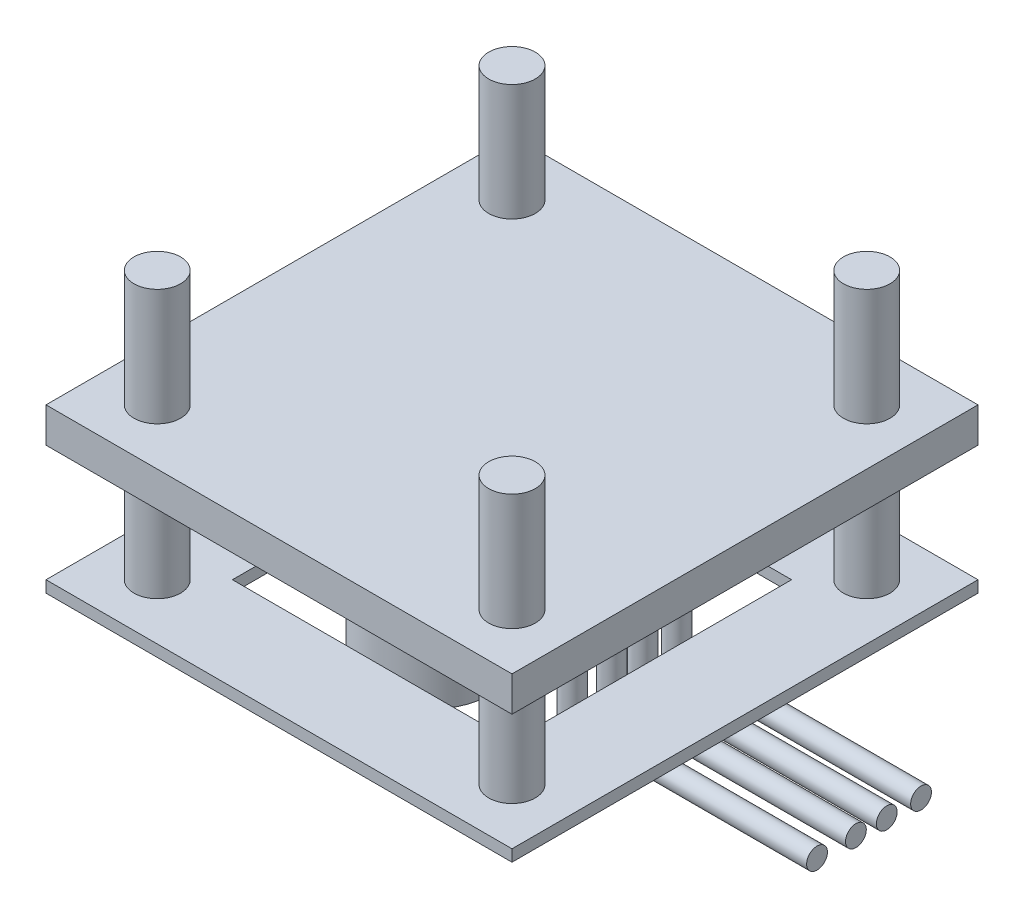
from build123d import *

# Parameters (mm, degrees)
SKETCH_2_W           = 40
SKETCH_2_H           = 40
SKETCH_2_W_2         = 24
SKETCH_2_H_2         = 24
EXTRUDE_2_DEPTH      = 1
SKETCH_3_R           = 2
SKETCH_3_R_2         = 5.125
SKETCH_3_W           = 3
SKETCH_3_H           = 12
CUT_EXTRUDE_1_DEPTH  = 3
EXTRUDE_START        = 10
SKETCH_9_W           = 40
SKETCH_9_H           = 40
EXTRUDE_4_DEPTH      = 3
SKETCH_3_3_R         = 2
EXTRUDE_5_DEPTH      = 24
EXTRUDE_START_2      = -2
SKETCH_2_8_R         = 2
EXTRUDE_6_DEPTH      = 2
SKETCH_11_W          = 28.649920568
SKETCH_11_H          = 15.870303346
EXTRUDE_7_DEPTH      = 2
EXTRUDE_8_DEPTH      = 10
EXTRUDE_8_DEPTH_BACK = 9.496904145
SKETCH_12_R          = 5.125
SKETCH_13_W          = 3
SKETCH_13_H          = 12
EXTRUDE_9_DEPTH      = 3
SKETCH_14_R          = 0.926290341
EXTRUDE_10_DEPTH     = 9
EXTRUDE_START_3      = 9.5
SKETCH_16_R          = 0.89368598
EXTRUDE_11_DEPTH     = 21


with BuildPart() as part:
    # 草图2 → 凸台-拉伸2 (new body)
    with BuildSketch(Plane(origin=(0, 0, 0), x_dir=(1, 0, 0), z_dir=(0, 1, 0))):
        Rectangle(SKETCH_2_W, SKETCH_2_H)
        Rectangle(SKETCH_2_W_2, SKETCH_2_H_2, mode=Mode.SUBTRACT)
    extrude(amount=EXTRUDE_2_DEPTH)

    # 草图3 → 切除-拉伸1 (cut)
    with BuildSketch(Plane(origin=(0, 0, 0), x_dir=(1, 0, 0), z_dir=(0, 1, 0))):
        with Locations((-15.224798987, -15.224798987)):
            Circle(SKETCH_3_R)
        with Locations((15.224798987, -15.224798987)):
            Circle(SKETCH_3_R)
        with Locations((15.224798987, 15.224798987)):
            Circle(SKETCH_3_R)
        with Locations((-15.224798987, 15.224798987)):
            Circle(SKETCH_3_R)
        with Locations((-7, 0)):
            Circle(SKETCH_3_R_2)
        with Locations((9.5, 0.011605537)):
            Rectangle(SKETCH_3_W, SKETCH_3_H)
    extrude(amount=CUT_EXTRUDE_1_DEPTH, mode=Mode.SUBTRACT)



with BuildPart() as body_2:
    # 草图9 → 凸台-拉伸4 (new body)
    with BuildSketch(Plane(origin=(0, 1, 0), x_dir=(1, 0, 0), z_dir=(0, 1, 0)).offset(EXTRUDE_START)):
        Rectangle(SKETCH_9_W, SKETCH_9_H)
    extrude(amount=EXTRUDE_4_DEPTH)

    # 草图3<3> → 凸台-拉伸5 (add)
    with BuildSketch(Plane(origin=(0, 0, 0), x_dir=(1, 0, 0), z_dir=(0, 1, 0))):
        with Locations((-15.224798987, -15.224798987)):
            Circle(SKETCH_3_3_R)
        with Locations((15.224798987, -15.224798987)):
            Circle(SKETCH_3_3_R)
        with Locations((15.224798987, 15.224798987)):
            Circle(SKETCH_3_3_R)
        with Locations((-15.224798987, 15.224798987)):
            Circle(SKETCH_3_3_R)
    extrude(amount=EXTRUDE_5_DEPTH)


with BuildPart() as part_1:
    add(part.part)

    add(body_2.part)  # 凸台-拉伸6 merges body 2
    # 草图2<8> → 凸台-拉伸6 (add)
    with BuildSketch(Plane(origin=(0, 0, 0), x_dir=(1, 0, 0), z_dir=(0, 1, 0)).offset(EXTRUDE_START_2)):
        with Locations((15.224798987, 15.224798987)):
            Circle(SKETCH_2_8_R)
        with Locations((-15.224798987, -15.224798987)):
            Circle(SKETCH_2_8_R)
        with Locations((15.224798987, -15.224798987)):
            Circle(SKETCH_2_8_R)
        with Locations((-15.224798987, 15.224798987)):
            Circle(SKETCH_2_8_R)
    extrude(amount=EXTRUDE_6_DEPTH)

    # 草图11 → 凸台-拉伸7 (add)
    with BuildSketch(Plane.XZ.offset(-11)):
        Rectangle(SKETCH_11_W, SKETCH_11_H)
    extrude(amount=EXTRUDE_7_DEPTH)

    # 草图12 → 凸台-拉伸8 (add, two sides: drawn at the far end of the back side and taken through both)
    with BuildSketch(Plane(origin=(0, 1, 0), x_dir=(1, 0, 0), z_dir=(0, 1, 0)).offset(-EXTRUDE_8_DEPTH_BACK)):
        with Locations((-7, 0)):
            Circle(SKETCH_12_R)
    extrude(amount=EXTRUDE_8_DEPTH + EXTRUDE_8_DEPTH_BACK)

    # 草图13 → 凸台-拉伸9 (add)
    with BuildSketch(Plane.XZ.offset(-9)):
        with Locations((9.5, -0.011605537)):
            Rectangle(SKETCH_13_W, SKETCH_13_H)
    extrude(amount=EXTRUDE_9_DEPTH)

    # 草图14 → 凸台-拉伸10 (add)
    with BuildSketch(Plane.XZ.offset(-6)):
        with Locations((9.612228669, 1.034181552)):
            Circle(SKETCH_14_R)
        with Locations((9.539517293, -4.593503512)):
            Circle(SKETCH_14_R)
        with Locations((9.612228669, -1.630416094)):
            Circle(SKETCH_14_R)
        with Locations((9.539517293, 4.349326871)):
            Circle(SKETCH_14_R)
    extrude(amount=EXTRUDE_10_DEPTH)

    # 草图16 → 凸台-拉伸11 (add)
    with BuildSketch(Plane(origin=(0, 0, 0), x_dir=(0, 0, -1), z_dir=(1, 0, 0)).offset(EXTRUDE_START_3)):
        with Locations((-4.31672251, -2.284079834)):
            Circle(SKETCH_16_R)
        with Locations((-0.981073298, -2.284079834)):
            Circle(SKETCH_16_R)
        with Locations((1.667824606, -2.284079834)):
            Circle(SKETCH_16_R)
        with Locations((4.6110445, -2.284079834)):
            Circle(SKETCH_16_R)
    extrude(amount=EXTRUDE_11_DEPTH)


solid = part_1.part
